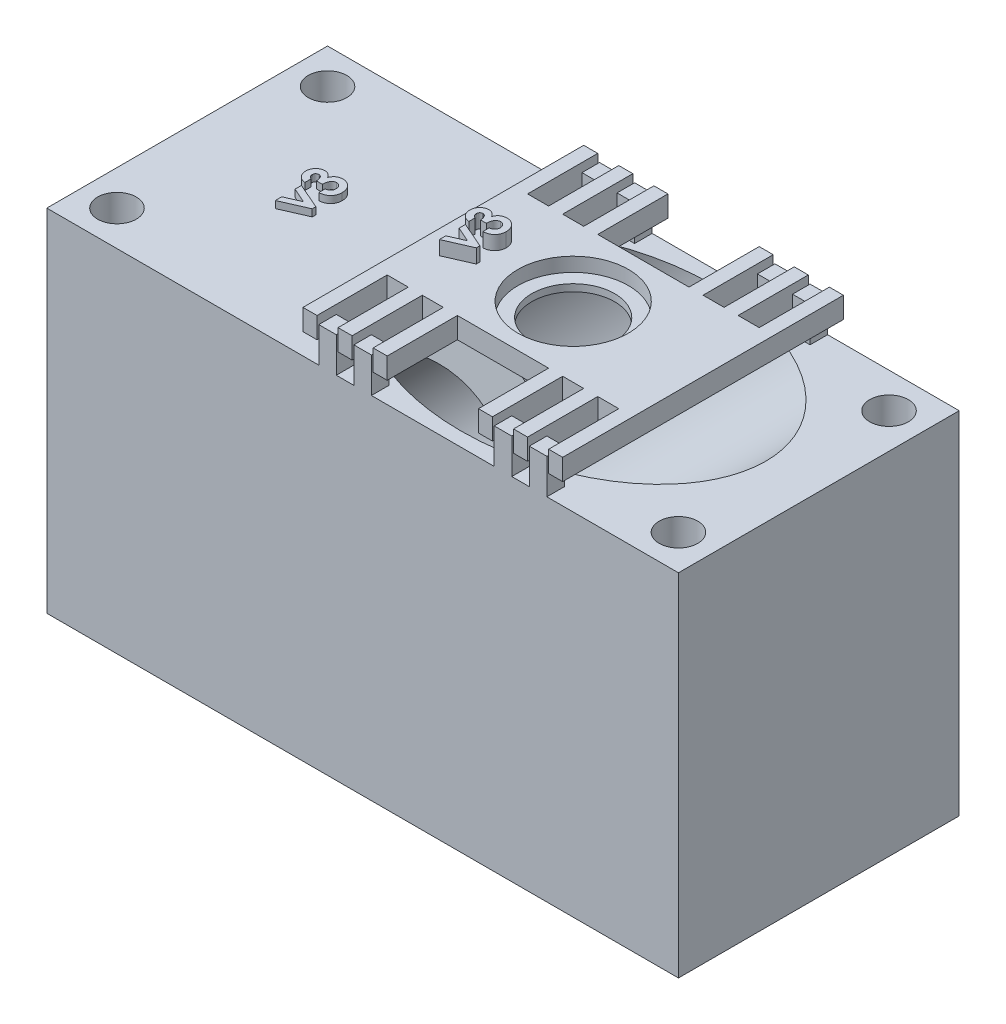
from build123d import *

# Parameters (mm, degrees)
SKETCH1_W            = 228.6
SKETCH1_H            = 127
BOSS_EXTRUDE1_DEPTH  = 50.8
SKETCH10_R           = 7.5
CUT_EXTRUDE6_DEPTH   = 196.514014843
SKETCH11_W           = 25
SKETCH11_H           = 25
CUT_EXTRUDE7_DEPTH   = 2.54
SKETCH13_W           = 6.35
SKETCH13_H           = 6.35
BOSS_EXTRUDE3_DEPTH  = 12.7
BOSS_EXTRUDE4_START  = -7.62
BOSS_EXTRUDE4_DEPTH  = 7.62
SKETCH4_R            = 14.9987
CUT_EXTRUDE9_DEPTH   = 206.74
SKETCH3_R            = 20.0025
CUT_EXTRUDE10_DEPTH  = 5.08
SKETCH7_R            = 6.985
CUT_EXTRUDE4_DEPTH   = 196.514014843
LPATTERN1_COUNT      = 2
LPATTERN1_PITCH      = 76.2
LPATTERN1_COUNT_DIR2 = 2
LPATTERN1_PITCH_DIR2 = 203.2
BOSS_EXTRUDE2_DEPTH  = 2.54
BOSS_EXTRUDE6_DEPTH  = 5.08


with BuildPart() as part:
    # Sketch1 → Boss-Extrude1 (new, symmetric)
    with BuildSketch(Plane.XY):
        with Locations((-25.4, -63.5)):
            Rectangle(SKETCH1_W, SKETCH1_H)
    extrude(amount=BOSS_EXTRUDE1_DEPTH, both=True)

    # Sketch10 → Cut-Extrude6 (cut, through all)
    with BuildSketch(Plane.XZ.offset(127)):
        Circle(SKETCH10_R)
    extrude(amount=-CUT_EXTRUDE6_DEPTH, mode=Mode.SUBTRACT)

    # Sketch11 → Cut-Extrude7 (cut)
    with BuildSketch(Plane.XZ.offset(127)):
        Rectangle(SKETCH11_W, SKETCH11_H)
    extrude(amount=-CUT_EXTRUDE7_DEPTH, mode=Mode.SUBTRACT)

    # Sketch2 → Cut-Revolve1 (revolve, cut)
    with BuildSketch(Plane.XY):
        Polygon((-108.275018762, -95.39450652), (-120.937179893, -82.73234539), (-82.681288817, -44.476454314), (-93.367793601, -33.78994953), (-64.657844072, -5.08), (0, 59.577844072), (29.864008255, 89.441852327), (59.72801651, 54.64801651), (0, -5.08), (-105.207008528, -110.287008528), (-129.286668415, -134.366668415), (-180.402882779, -185.482882779), (-189.3831389, -176.502626658), align=None)
    revolve(axis=Axis((-124.923032936, -130.003032936, 0), (0.7071067811865462, 0.7071067811865489, 0)), mode=Mode.SUBTRACT)

    # Sketch13 → Boss-Extrude3 (add)
    with BuildSketch(Plane(origin=(0, 0, 0), x_dir=(1, 0, 0), z_dir=(0, 1, 0))):
        with Locations((-38.1, 47.625)):
            Rectangle(SKETCH13_W, SKETCH13_H)
        with Locations((-25.4, 47.625)):
            Rectangle(SKETCH13_W, SKETCH13_H)
        with Locations((25.4, 47.625)):
            Rectangle(SKETCH13_W, SKETCH13_H)
        with Locations((38.1, 47.625)):
            Rectangle(SKETCH13_W, SKETCH13_H)
        with Locations((38.1, -47.625)):
            Rectangle(SKETCH13_W, SKETCH13_H)
        with Locations((25.4, -47.625)):
            Rectangle(SKETCH13_W, SKETCH13_H)
        with Locations((-25.4, -47.625)):
            Rectangle(SKETCH13_W, SKETCH13_H)
        with Locations((-38.1, -47.625)):
            Rectangle(SKETCH13_W, SKETCH13_H)
    extrude(amount=BOSS_EXTRUDE3_DEPTH)

    # Sketch7 → Cut-Extrude4 (cut, through all)
    with BuildSketch(Plane(origin=(0, 0, 0), x_dir=(1, 0, 0), z_dir=(0, 1, 0))):
        with Locations((76.2, 38.1)):
            Circle(SKETCH7_R)
    cut_extrude4 = extrude(amount=-CUT_EXTRUDE4_DEPTH, mode=Mode.SUBTRACT)

    # LPattern1: Cut-Extrude4 2 × 2
    with Locations(*[(-j * LPATTERN1_PITCH_DIR2, 0, i * LPATTERN1_PITCH) for i in range(LPATTERN1_COUNT) for j in range(LPATTERN1_COUNT_DIR2) if (i, j) != (0, 0)]):
        add(cut_extrude4, mode=Mode.SUBTRACT)

    # Sketch8 → Boss-Extrude2 (add)
    with BuildSketch(Plane(origin=(0, 0, 0), x_dir=(1, 0, 0), z_dir=(0, 1, 0))):
        Polygon((-98.180769231, -9.606410256), (-98.180769231, -7.286217949), (-92.703385417, -4.884615385), (-98.180769231, -2.483012821), (-98.180769231, -0.162820513), (-88.9, -4.228245192), (-88.9, -5.540985577), align=None)
        with BuildLine():
            Line((-98.506410256, 3.663461538), (-98.506410256, 1.383974359))
            add(Edge.make_bspline(
                [(-98.506410256, 1.383974359), (-98.620378624, 1.399968007), (-98.84298705, 1.431207559), (-99.166039546, 1.508002967), (-99.47323864, 1.596812199), (-99.762935688, 1.710386648), (-100.034818395, 1.841487859), (-100.28913006, 1.994369664), (-100.529520266, 2.161938249), (-100.673578679, 2.293133974), (-100.745192308, 2.358353365)],
                knots=[0, 0, 0, 0, 1.1115466, 2.171125598, 3.205689823, 4.19946166, 5.17440286, 6.118867946, 7.064860634, 8, 8, 8, 8], degree=3))
            add(Edge.make_bspline(
                [(-100.745192308, 2.358353365), (-100.839827381, 2.452191695), (-101.026343165, 2.637137179), (-101.265249282, 2.946202776), (-101.472006279, 3.270160599), (-101.635924721, 3.615507763), (-101.76859771, 3.976870408), (-101.857714457, 4.357122213), (-101.916844205, 4.754709333), (-101.922668692, 5.026012525), (-101.925641026, 5.164463141)],
                knots=[0, 0, 0, 0, 1.01925491, 2.00884431, 2.983262333, 3.955970413, 4.92937149, 5.924503185, 6.940838805, 8, 8, 8, 8], degree=3))
            add(Edge.make_bspline(
                [(-101.925641026, 5.164463141), (-101.922735119, 5.287552863), (-101.917022691, 5.529522452), (-101.87116642, 5.885156864), (-101.790739627, 6.224224514), (-101.6855834, 6.550309447), (-101.542500779, 6.858616014), (-101.37641231, 7.155948841), (-101.172697901, 7.434000439), (-100.94252112, 7.693421395), (-100.693562398, 7.931749021), (-100.427445999, 8.13814179), (-100.151280504, 8.315581356), (-99.862771502, 8.461768089), (-99.561430799, 8.574165821), (-99.2489992, 8.652173181), (-98.926166109, 8.703230891), (-98.706740806, 8.708317573), (-98.595452724, 8.710897436)],
                knots=[0, 0, 0, 0, 1.091422571, 2.145516843, 3.172569842, 4.178562979, 5.178154469, 6.181868002, 7.194278174, 8.227918432, 9.254613415, 10.245994977, 11.209837596, 12.161663635, 13.10878368, 14.055455738, 15.013766427, 16, 16, 16, 16], degree=3))
            add(Edge.make_bspline(
                [(-98.595452724, 8.710897436), (-98.457656169, 8.705501471), (-98.185546113, 8.694845934), (-97.788076402, 8.610576267), (-97.408887601, 8.475107971), (-97.052472557, 8.282492129), (-96.719202548, 8.040608716), (-96.420717201, 7.743984546), (-96.152393944, 7.400897226), (-96.008195183, 7.143344164), (-95.934354968, 7.011458333)],
                knots=[0, 0, 0, 0, 0.992776698, 1.96045919, 2.915875678, 3.886951799, 4.871409521, 5.874469288, 6.911574252, 8, 8, 8, 8], degree=3))
            add(Edge.make_bspline(
                [(-95.934354968, 7.011458333), (-95.904637686, 7.101986129), (-95.84624456, 7.279869187), (-95.731168925, 7.532657584), (-95.605677553, 7.773228315), (-95.459179797, 7.996079611), (-95.301829774, 8.20732264), (-95.125167239, 8.400273958), (-94.933726838, 8.579929977), (-94.725472005, 8.741846227), (-94.503865267, 8.886606861), (-94.272889676, 9.014182994), (-94.031701053, 9.121243348), (-93.782071807, 9.211098566), (-93.521545171, 9.279655609), (-93.251004037, 9.327887975), (-92.971100266, 9.355776545), (-92.781464321, 9.360029185), (-92.685576923, 9.362179487)],
                knots=[0, 0, 0, 0, 1.059375415, 2.081625174, 3.086260357, 4.075579879, 5.045586876, 6.014170127, 6.982201689, 7.963705737, 8.945119069, 9.924852636, 10.896327119, 11.878239286, 12.873838556, 13.889973282, 14.933087432, 16, 16, 16, 16], degree=3))
            add(Edge.make_bspline(
                [(-92.685576923, 9.362179487), (-92.544661498, 9.357820177), (-92.266804979, 9.349224506), (-91.857551527, 9.294575909), (-91.467361773, 9.19283403), (-91.091759923, 9.05897385), (-90.735543277, 8.880467923), (-90.3907333, 8.670216326), (-90.069023387, 8.412861837), (-89.764239636, 8.124262914), (-89.485792167, 7.805430335), (-89.239780739, 7.462345795), (-89.036983334, 7.094344582), (-88.86364476, 6.710323559), (-88.73500028, 6.301631561), (-88.640792179, 5.873555325), (-88.583473106, 5.422968873), (-88.577440082, 5.115447029), (-88.574358974, 4.958393429)],
                knots=[0, 0, 0, 0, 1.005228408, 1.982105694, 2.937129188, 3.876607107, 4.82066901, 5.774063015, 6.75178259, 7.752926466, 8.764612432, 9.766578198, 10.757677051, 11.756882247, 12.76686714, 13.807379907, 14.880213281, 16, 16, 16, 16], degree=3))
            add(Edge.make_bspline(
                [(-88.574358974, 4.958393429), (-88.577600049, 4.809820095), (-88.583937541, 4.5193046), (-88.638791748, 4.094364886), (-88.727276036, 3.690499912), (-88.852001977, 3.306679007), (-89.013750207, 2.944387143), (-89.206356057, 2.600338917), (-89.440928583, 2.281399735), (-89.70687874, 1.984015988), (-90.005259714, 1.714784543), (-90.329159661, 1.474155034), (-90.679810238, 1.267433383), (-91.055713319, 1.093771823), (-91.457528352, 0.954527994), (-91.884438226, 0.84469287), (-92.33727699, 0.767971238), (-92.648839693, 0.744605505), (-92.807692308, 0.732692308)],
                knots=[0, 0, 0, 0, 1.066544725, 2.085487077, 3.070979577, 4.031932826, 4.977951092, 5.916076795, 6.857635327, 7.814973522, 8.776389752, 9.738577119, 10.707772778, 11.69409279, 12.707140348, 13.757286496, 14.856535458, 16, 16, 16, 16], degree=3))
            Line((-92.807692308, 0.732692308), (-92.807692308, 3.012179487))
            add(Edge.make_bspline(
                [(-92.807692308, 3.012179487), (-92.727820459, 3.026627177), (-92.572249088, 3.054767841), (-92.346994177, 3.109604853), (-92.139151804, 3.181253072), (-91.947194999, 3.263168246), (-91.769153772, 3.353735088), (-91.609789261, 3.461946762), (-91.462838431, 3.577973685), (-91.293928353, 3.752388588), (-91.116790416, 3.995737335), (-90.95990895, 4.325217228), (-90.870684552, 4.6934044), (-90.859583771, 4.950281718), (-90.853846154, 5.083052885)],
                knots=[0, 0, 0, 0, 0.928450228, 1.808400301, 2.64896863, 3.43999153, 4.194978884, 4.9294959, 5.640047715, 6.332896648, 7.70085756, 9.063442004, 10.482192841, 12, 12, 12, 12], degree=3))
            add(Edge.make_bspline(
                [(-90.853846154, 5.083052885), (-90.855061209, 5.15351571), (-90.857441231, 5.291536621), (-90.883581109, 5.49432054), (-90.927133517, 5.687302879), (-90.984715528, 5.872086285), (-91.062854, 6.045766832), (-91.153533438, 6.212276948), (-91.264538799, 6.368571523), (-91.391018873, 6.513740077), (-91.526076304, 6.648843549), (-91.673864536, 6.764206269), (-91.827287284, 6.863804668), (-91.990402628, 6.942394505), (-92.158061301, 7.008169337), (-92.335592225, 7.04919208), (-92.519141829, 7.079980328), (-92.644733293, 7.081779295), (-92.708473558, 7.082692308)],
                knots=[0, 0, 0, 0, 1.110702965, 2.175618623, 3.217100552, 4.227908035, 5.221854906, 6.215531843, 7.213608581, 8.237687243, 9.249555755, 10.220750668, 11.188994735, 12.127982202, 13.071814005, 14.022160605, 14.996205625, 16, 16, 16, 16], degree=3))
            add(Edge.make_bspline(
                [(-92.708473558, 7.082692308), (-92.778207073, 7.080370542), (-92.916196411, 7.07577621), (-93.118413177, 7.035346307), (-93.313682663, 6.974828708), (-93.500393747, 6.887793167), (-93.677448362, 6.773903287), (-93.846312878, 6.635424873), (-94.005642859, 6.471105213), (-94.160078638, 6.286446933), (-94.295270986, 6.073999391), (-94.419762923, 5.842341557), (-94.518889189, 5.585766344), (-94.607405679, 5.310429031), (-94.672062147, 5.011152624), (-94.719007476, 4.689786495), (-94.753951463, 4.346851689), (-94.758964716, 4.11046216), (-94.761538462, 3.989102564)],
                knots=[0, 0, 0, 0, 0.809868251, 1.602574917, 2.388262527, 3.182133002, 3.988875265, 4.829537611, 5.714850619, 6.646378958, 7.622533229, 8.636771727, 9.698525113, 10.814716514, 11.996253919, 13.252421425, 14.589425562, 16, 16, 16, 16], degree=3))
            Line((-94.761538462, 3.989102564), (-96.878205128, 3.989102564))
            add(Edge.make_bspline(
                [(-96.878205128, 3.989102564), (-96.891025198, 4.140220899), (-96.91500901, 4.422933377), (-96.971885491, 4.815083576), (-97.045462166, 5.146347575), (-97.141352516, 5.420511801), (-97.25335935, 5.651929873), (-97.383138062, 5.851257006), (-97.532164622, 6.025163956), (-97.70022189, 6.16820968), (-97.876380174, 6.287417238), (-98.063733703, 6.369021103), (-98.254828221, 6.423717793), (-98.385628856, 6.42886153), (-98.450440705, 6.431410256)],
                knots=[0, 0, 0, 0, 1.700711886, 3.181695139, 4.441392523, 5.500267777, 6.431839453, 7.31822765, 8.161090383, 8.990537424, 9.787217293, 10.536619396, 11.274893404, 12, 12, 12, 12], degree=3))
            add(Edge.make_bspline(
                [(-98.450440705, 6.431410256), (-98.533141991, 6.427031203), (-98.694557394, 6.418484219), (-98.925988837, 6.350801813), (-99.133383987, 6.235941969), (-99.314423048, 6.080095471), (-99.46209898, 5.888636352), (-99.571931859, 5.667057291), (-99.636004315, 5.416481068), (-99.642694048, 5.240310623), (-99.646153846, 5.149198718)],
                knots=[0, 0, 0, 0, 1.009324788, 1.969988301, 2.915956825, 3.885795408, 4.868116622, 5.850437836, 6.888288533, 8, 8, 8, 8], degree=3))
            add(Edge.make_bspline(
                [(-99.646153846, 5.149198718), (-99.642088477, 5.066606248), (-99.63402154, 4.902717492), (-99.573812059, 4.663063076), (-99.472456892, 4.435471225), (-99.332694088, 4.224654724), (-99.164844886, 4.033656753), (-98.966062347, 3.876902524), (-98.748255876, 3.746521788), (-98.587341496, 3.691256828), (-98.506410256, 3.663461538)],
                knots=[0, 0, 0, 0, 0.98818071, 1.960853194, 2.938124878, 3.957524365, 4.978590984, 5.968022688, 6.978025184, 8, 8, 8, 8], degree=3))
        make_face()
    extrude(amount=BOSS_EXTRUDE2_DEPTH)


with BuildPart() as body_2:
    # Sketch14 → Boss-Extrude4 (new body)
    with BuildSketch(Plane(origin=(0, 0, 0), x_dir=(-1, 0, 0), z_dir=(0, -1, 0)).offset(BOSS_EXTRUDE4_START)):
        Polygon((16.51, 25.4), (-16.51, 25.4), (-16.51, 50.8), (-21.59, 50.8), (-21.59, 25.4), (-29.21, 25.4), (-29.21, 50.8), (-34.29, 50.8), (-34.29, 25.4), (-41.91, 25.4), (-41.91, 50.8), (-46.99, 50.8), (-46.99, -50.8), (-41.91, -50.8), (-41.91, -25.4), (-34.29, -25.4), (-34.29, -50.8), (-29.21, -50.8), (-29.21, -25.4), (-21.59, -25.4), (-21.59, -50.8), (-16.51, -50.8), (-16.51, -25.4), (16.51, -25.4), (16.51, -50.8), (21.59, -50.8), (21.59, -25.4), (29.21, -25.4), (29.21, -50.8), (34.29, -50.8), (34.29, -25.4), (41.91, -25.4), (41.91, -50.8), (46.99, -50.8), (46.99, 50.8), (41.91, 50.8), (41.91, 25.4), (34.29, 25.4), (34.29, 50.8), (29.21, 50.8), (29.21, 25.4), (21.59, 25.4), (21.59, 50.8), (16.51, 50.8), align=None)
    extrude(amount=-BOSS_EXTRUDE4_DEPTH)

    # Sketch4 → Cut-Extrude9 (cut, through all)
    with BuildSketch(Plane(origin=(0, 15.24, 0), x_dir=(1, 0, 0), z_dir=(0, 1, 0))):
        Circle(SKETCH4_R)
    extrude(amount=-CUT_EXTRUDE9_DEPTH, mode=Mode.SUBTRACT)

    # Sketch3 → Cut-Extrude10 (cut)
    with BuildSketch(Plane(origin=(0, 15.24, 0), x_dir=(1, 0, 0), z_dir=(0, 1, 0))):
        Circle(SKETCH3_R)
    extrude(amount=-CUT_EXTRUDE10_DEPTH, mode=Mode.SUBTRACT)

    # Sketch15 → Boss-Extrude6 (add)
    with BuildSketch(Plane(origin=(0, 15.24, -15.24), x_dir=(1, 0, 0), z_dir=(0, -1, 0))):
        with BuildLine():
            Line((-38.816410256, 11.902179487), (-38.816410256, 14.181666667))
            add(Edge.make_bspline(
                [(-38.816410256, 14.181666667), (-38.930378624, 14.165673019), (-39.15298705, 14.134433466), (-39.476039546, 14.057638059), (-39.78323864, 13.968828826), (-40.072935688, 13.855254378), (-40.344818395, 13.724153166), (-40.59913006, 13.571271362), (-40.839520266, 13.403702777), (-40.983578679, 13.272507052), (-41.055192308, 13.20728766)],
                knots=[0, 0, 0, 0, 1.1115466, 2.171125598, 3.205689823, 4.19946166, 5.17440286, 6.118867946, 7.064860634, 8, 8, 8, 8], degree=3))
            add(Edge.make_bspline(
                [(-41.055192308, 13.20728766), (-41.149827381, 13.113449331), (-41.336343165, 12.928503846), (-41.575249282, 12.619438249), (-41.782006279, 12.295480427), (-41.945924721, 11.950133262), (-42.07859771, 11.588770618), (-42.167714457, 11.208518813), (-42.226844205, 10.810931693), (-42.232668692, 10.539628501), (-42.235641026, 10.401177885)],
                knots=[0, 0, 0, 0, 1.01925491, 2.00884431, 2.983262333, 3.955970413, 4.92937149, 5.924503185, 6.940838805, 8, 8, 8, 8], degree=3))
            add(Edge.make_bspline(
                [(-42.235641026, 10.401177885), (-42.232735119, 10.278088163), (-42.227022691, 10.036118574), (-42.18116642, 9.680484162), (-42.100739627, 9.341416511), (-41.9955834, 9.015331579), (-41.852500779, 8.707025012), (-41.68641231, 8.409692184), (-41.482697901, 8.131640586), (-41.25252112, 7.87221963), (-41.003562398, 7.633892004), (-40.737445999, 7.427499236), (-40.461280504, 7.250059669), (-40.172771502, 7.103872936), (-39.871430799, 6.991475204), (-39.5589992, 6.913467845), (-39.236166109, 6.862410134), (-39.016740806, 6.857323452), (-38.905452724, 6.85474359)],
                knots=[0, 0, 0, 0, 1.091422571, 2.145516843, 3.172569842, 4.178562979, 5.178154469, 6.181868002, 7.194278174, 8.227918432, 9.254613415, 10.245994977, 11.209837596, 12.161663635, 13.10878368, 14.055455738, 15.013766427, 16, 16, 16, 16], degree=3))
            add(Edge.make_bspline(
                [(-38.905452724, 6.85474359), (-38.767656169, 6.860139555), (-38.495546113, 6.870795092), (-38.098076402, 6.955064759), (-37.718887601, 7.090533055), (-37.362472557, 7.283148897), (-37.029202548, 7.525032309), (-36.730717201, 7.82165648), (-36.462393944, 8.1647438), (-36.318195183, 8.422296862), (-36.244354968, 8.554182692)],
                knots=[0, 0, 0, 0, 0.992776698, 1.96045919, 2.915875678, 3.886951799, 4.871409521, 5.874469288, 6.911574252, 8, 8, 8, 8], degree=3))
            add(Edge.make_bspline(
                [(-36.244354968, 8.554182692), (-36.214637686, 8.463654897), (-36.15624456, 8.285771838), (-36.041168925, 8.032983442), (-35.915677553, 7.792412711), (-35.769179797, 7.569561415), (-35.611829774, 7.358318385), (-35.435167239, 7.165367067), (-35.243726838, 6.985711049), (-35.035472005, 6.823794799), (-34.813865267, 6.679034164), (-34.582889676, 6.551458032), (-34.341701053, 6.444397678), (-34.092071807, 6.354542459), (-33.831545171, 6.285985417), (-33.561004037, 6.237753051), (-33.281100266, 6.20986448), (-33.091464321, 6.205611841), (-32.995576923, 6.203461538)],
                knots=[0, 0, 0, 0, 1.059375415, 2.081625174, 3.086260357, 4.075579879, 5.045586876, 6.014170127, 6.982201689, 7.963705737, 8.945119069, 9.924852636, 10.896327119, 11.878239286, 12.873838556, 13.889973282, 14.933087432, 16, 16, 16, 16], degree=3))
            add(Edge.make_bspline(
                [(-32.995576923, 6.203461538), (-32.854661498, 6.207820848), (-32.576804979, 6.21641652), (-32.167551527, 6.271065117), (-31.777361773, 6.372806996), (-31.401759923, 6.506667175), (-31.045543277, 6.685173103), (-30.7007333, 6.895424699), (-30.379023387, 7.152779188), (-30.074239636, 7.441378111), (-29.795792167, 7.760210691), (-29.549780739, 8.103295231), (-29.346983334, 8.471296444), (-29.17364476, 8.855317467), (-29.04500028, 9.264009464), (-28.950792179, 9.692085701), (-28.893473106, 10.142672153), (-28.887440082, 10.450193997), (-28.884358974, 10.607247596)],
                knots=[0, 0, 0, 0, 1.005228408, 1.982105694, 2.937129188, 3.876607107, 4.82066901, 5.774063015, 6.75178259, 7.752926466, 8.764612432, 9.766578198, 10.757677051, 11.756882247, 12.76686714, 13.807379907, 14.880213281, 16, 16, 16, 16], degree=3))
            add(Edge.make_bspline(
                [(-28.884358974, 10.607247596), (-28.887600049, 10.755820931), (-28.893937541, 11.046336426), (-28.948791748, 11.471276139), (-29.037276036, 11.875141114), (-29.162001977, 12.258962019), (-29.323750207, 12.621253883), (-29.516356057, 12.965302109), (-29.750928583, 13.28424129), (-30.01687874, 13.581625038), (-30.315259714, 13.850856483), (-30.639159661, 14.091485992), (-30.989810238, 14.298207643), (-31.365713319, 14.471869203), (-31.767528352, 14.611113032), (-32.194438226, 14.720948156), (-32.64727699, 14.797669787), (-32.958839693, 14.821035521), (-33.117692308, 14.832948718)],
                knots=[0, 0, 0, 0, 1.066544725, 2.085487077, 3.070979577, 4.031932826, 4.977951092, 5.916076795, 6.857635327, 7.814973522, 8.776389752, 9.738577119, 10.707772778, 11.69409279, 12.707140348, 13.757286496, 14.856535458, 16, 16, 16, 16], degree=3))
            Line((-33.117692308, 14.832948718), (-33.117692308, 12.553461538))
            add(Edge.make_bspline(
                [(-33.117692308, 12.553461538), (-33.037820459, 12.539013849), (-32.882249088, 12.510873185), (-32.656994177, 12.456036173), (-32.449151804, 12.384387954), (-32.257194999, 12.30247278), (-32.079153772, 12.211905938), (-31.919789261, 12.103694264), (-31.772838431, 11.987667341), (-31.603928353, 11.813252438), (-31.426790416, 11.569903691), (-31.26990895, 11.240423797), (-31.180684552, 10.872236626), (-31.169583771, 10.615359308), (-31.163846154, 10.482588141)],
                knots=[0, 0, 0, 0, 0.928450228, 1.808400301, 2.64896863, 3.43999153, 4.194978884, 4.9294959, 5.640047715, 6.332896648, 7.70085756, 9.063442004, 10.482192841, 12, 12, 12, 12], degree=3))
            add(Edge.make_bspline(
                [(-31.163846154, 10.482588141), (-31.165061209, 10.412125316), (-31.167441231, 10.274104404), (-31.193581109, 10.071320486), (-31.237133517, 9.878338146), (-31.294715528, 9.693554741), (-31.372854, 9.519874194), (-31.463533438, 9.353364078), (-31.574538799, 9.197069503), (-31.701018873, 9.051900948), (-31.836076304, 8.916797476), (-31.983864536, 8.801434757), (-32.137287284, 8.701836358), (-32.300402628, 8.623246521), (-32.468061301, 8.557471689), (-32.645592225, 8.516448946), (-32.829141829, 8.485660698), (-32.954733293, 8.483861731), (-33.018473558, 8.482948718)],
                knots=[0, 0, 0, 0, 1.110702965, 2.175618623, 3.217100552, 4.227908035, 5.221854906, 6.215531843, 7.213608581, 8.237687243, 9.249555755, 10.220750668, 11.188994735, 12.127982202, 13.071814005, 14.022160605, 14.996205625, 16, 16, 16, 16], degree=3))
            add(Edge.make_bspline(
                [(-33.018473558, 8.482948718), (-33.088207073, 8.485270484), (-33.226196411, 8.489864816), (-33.428413177, 8.530294718), (-33.623682663, 8.590812318), (-33.810393747, 8.677847859), (-33.987448362, 8.791737738), (-34.156312878, 8.930216153), (-34.315642859, 9.094535812), (-34.470078638, 9.279194093), (-34.605270986, 9.491641634), (-34.729762923, 9.723299469), (-34.828889189, 9.979874682), (-34.917405679, 10.255211995), (-34.982062147, 10.554488402), (-35.029007476, 10.875854531), (-35.063951463, 11.218789336), (-35.068964716, 11.455178865), (-35.071538462, 11.576538462)],
                knots=[0, 0, 0, 0, 0.809868251, 1.602574917, 2.388262527, 3.182133002, 3.988875265, 4.829537611, 5.714850619, 6.646378958, 7.622533229, 8.636771727, 9.698525113, 10.814716514, 11.996253919, 13.252421425, 14.589425562, 16, 16, 16, 16], degree=3))
            Line((-35.071538462, 11.576538462), (-37.188205128, 11.576538462))
            add(Edge.make_bspline(
                [(-37.188205128, 11.576538462), (-37.201025198, 11.425420127), (-37.22500901, 11.142707649), (-37.281885491, 10.75055745), (-37.355462166, 10.419293451), (-37.451352516, 10.145129225), (-37.56335935, 9.913711153), (-37.693138062, 9.714384019), (-37.842164622, 9.54047707), (-38.01022189, 9.397431345), (-38.186380174, 9.278223788), (-38.373733703, 9.196619923), (-38.564828221, 9.141923232), (-38.695628856, 9.136779496), (-38.760440705, 9.134230769)],
                knots=[0, 0, 0, 0, 1.700711886, 3.181695139, 4.441392523, 5.500267777, 6.431839453, 7.31822765, 8.161090383, 8.990537424, 9.787217293, 10.536619396, 11.274893404, 12, 12, 12, 12], degree=3))
            add(Edge.make_bspline(
                [(-38.760440705, 9.134230769), (-38.843141991, 9.138609822), (-39.004557394, 9.147156807), (-39.235988837, 9.214839212), (-39.443383987, 9.329699057), (-39.624423048, 9.485545555), (-39.77209898, 9.677004674), (-39.881931859, 9.898583735), (-39.946004315, 10.149159958), (-39.952694048, 10.325330403), (-39.956153846, 10.416442308)],
                knots=[0, 0, 0, 0, 1.009324788, 1.969988301, 2.915956825, 3.885795408, 4.868116622, 5.850437836, 6.888288533, 8, 8, 8, 8], degree=3))
            add(Edge.make_bspline(
                [(-39.956153846, 10.416442308), (-39.952088477, 10.499034777), (-39.94402154, 10.662923534), (-39.883812059, 10.90257795), (-39.782456892, 11.130169801), (-39.642694088, 11.340986301), (-39.474844886, 11.531984273), (-39.276062347, 11.688738502), (-39.058255876, 11.819119237), (-38.897341496, 11.874384198), (-38.816410256, 11.902179487)],
                knots=[0, 0, 0, 0, 0.98818071, 1.960853194, 2.938124878, 3.957524365, 4.978590984, 5.968022688, 6.978025184, 8, 8, 8, 8], degree=3))
        make_face()
        Polygon((-38.490769231, 25.172051282), (-38.490769231, 22.851858974), (-33.013385417, 20.45025641), (-38.490769231, 18.048653846), (-38.490769231, 15.728461538), (-29.21, 19.793886218), (-29.21, 21.106626603), align=None)
    extrude(amount=-BOSS_EXTRUDE6_DEPTH)


solid = Compound([part.part, body_2.part])
